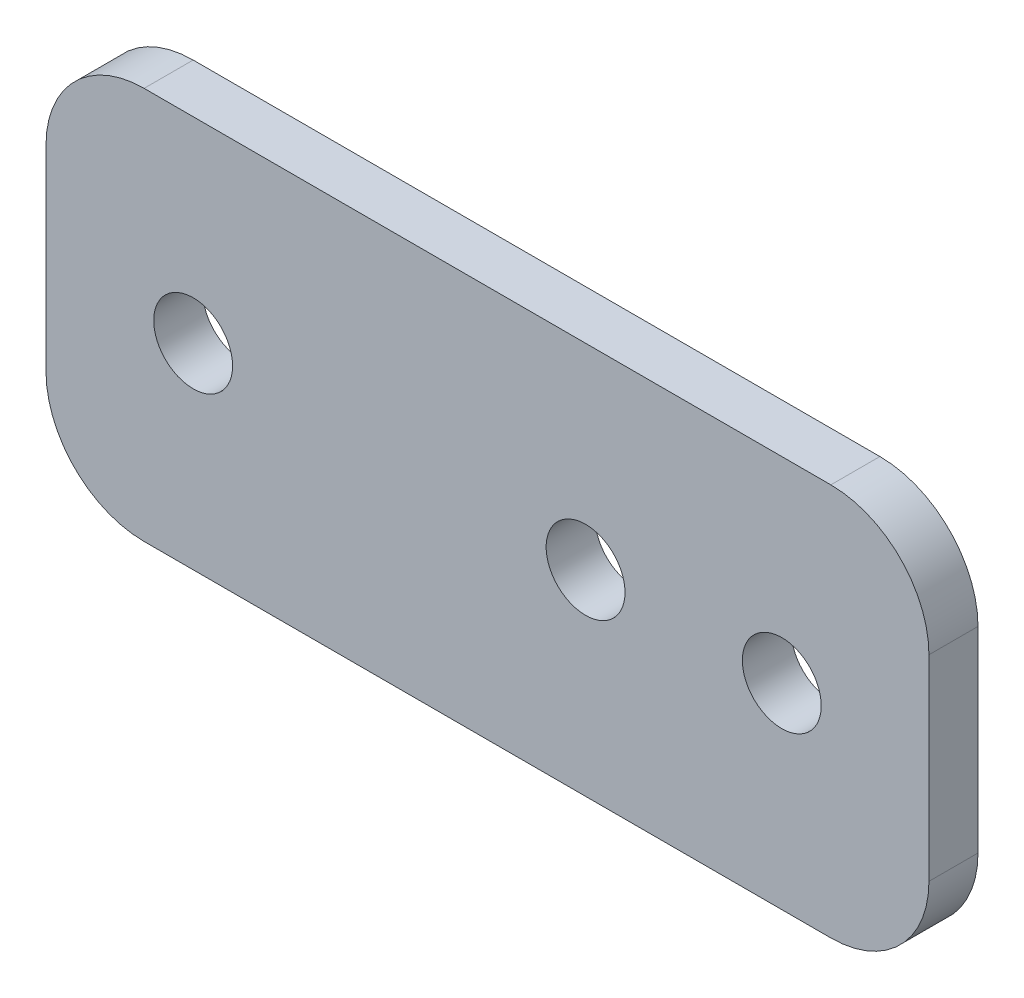
from build123d import *

# Parameters (mm, degrees)
SKETCH1_W           = 57.15
SKETCH1_H           = 25.4
SKETCH1_R           = 2.5527
BOSS_EXTRUDE1_DEPTH = 3.175
FILLET1_R           = 6.35


with BuildPart() as part:
    # Sketch1 → Boss-Extrude1 (new body)
    with BuildSketch(Plane.XY):
        with Locations((28.575, -12.7)):
            Rectangle(SKETCH1_W, SKETCH1_H)
        with Locations((9.525, -12.7)):
            Circle(SKETCH1_R, mode=Mode.SUBTRACT)
        with Locations((34.925, -12.7)):
            Circle(SKETCH1_R, mode=Mode.SUBTRACT)
        with Locations((47.625, -12.7)):
            Circle(SKETCH1_R, mode=Mode.SUBTRACT)
    extrude(amount=BOSS_EXTRUDE1_DEPTH)

    # Fillet1
    fillet1_edges = [part.edges().sort_by_distance(p)[0] for p in [
        (0, -25.4, 1.5875),
        (57.15, -25.4, 1.5875),
        (57.15, 0, 1.5875),
        (0, 0, 1.5875),
    ]]
    fillet(fillet1_edges, radius=FILLET1_R)


solid = part.part
